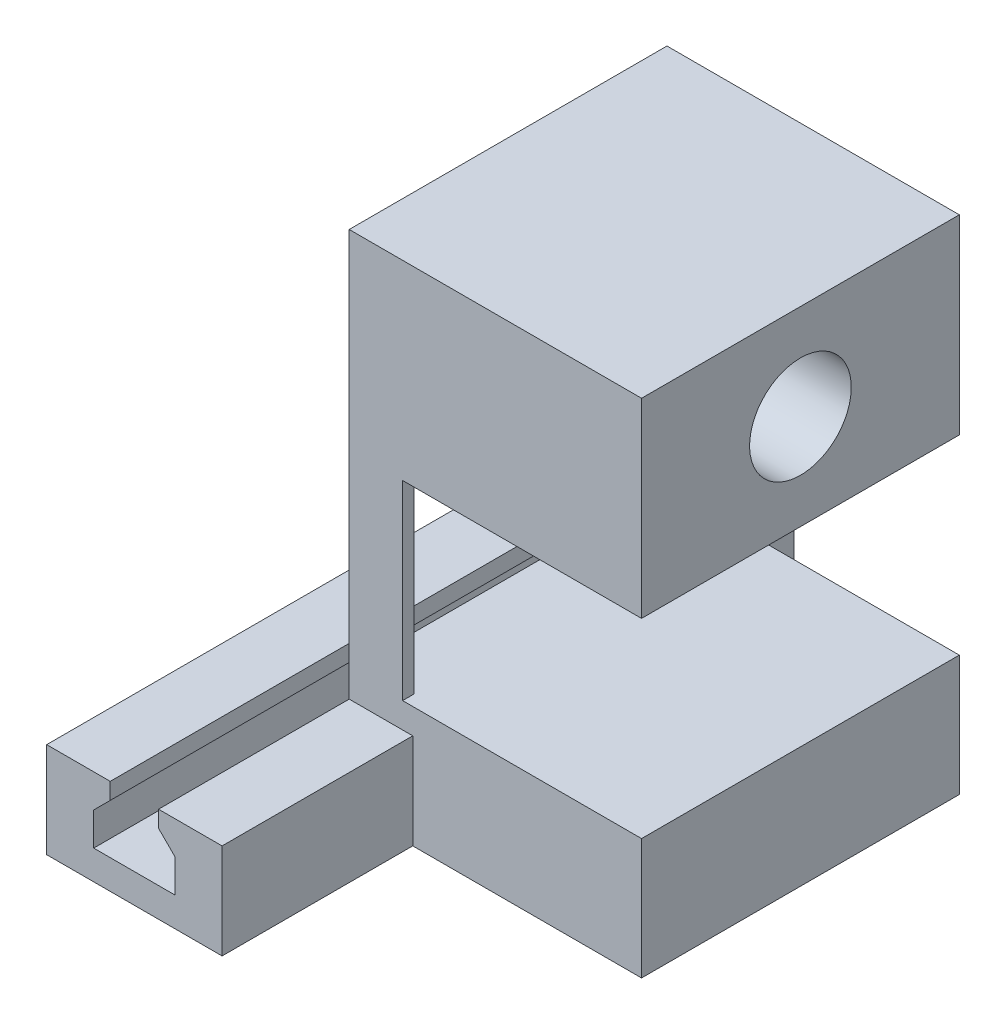
from build123d import *

# Parameters (mm, degrees)
BOSS_EXTRU_1_DEPTH      = 45
ESQUISSE6_W             = 25
ESQUISSE6_H             = 7.5
BOSS_EXTRU_6_DEPTH      = 18
ESQUISSE7_W             = 23
ESQUISSE7_H             = 25
BOSS_EXTRU_7_DEPTH      = 2
ESQUISSE8_W             = 4.2
ESQUISSE8_H             = 0.9
BOSS_EXTRU_8_DEPTH      = 20
BOSS_EXTRU_9_DEPTH      = 10
BOSS_EXTRU_9_DEPTH_BACK = 5
ESQUISSE9_W             = 23
ESQUISSE9_H             = 25
ESQUISSE10_R            = 4
ENL_V_MAT_EXTRU_1_DEPTH = 67.483682208


with BuildPart() as part:
    # Esquisse1 → Boss.-Extru.1 (new body)
    with BuildSketch(Plane.XY):
        Polygon((-3.2, 0), (3.2, 0), (3.2, 2.6), (1.9, 3.9), (1.9, 5.2), (6.9, 5.2), (6.9, -2.3), (-6.9, -2.3), (-6.9, 5.2), (-1.9, 5.2), (-1.9, 3.9), (-3.2, 2.6), align=None)
    extrude(amount=BOSS_EXTRU_1_DEPTH)

    # Esquisse6 → Boss.-Extru.6 (add)
    with BuildSketch(Plane(origin=(6.9, 0, 0), x_dir=(0, 0, -1), z_dir=(1, 0, 0))):
        with Locations((-17.5, 1.45)):
            Rectangle(ESQUISSE6_W, ESQUISSE6_H)
    extrude(amount=BOSS_EXTRU_6_DEPTH)

    # Esquisse7 → Boss.-Extru.7 (add)
    with BuildSketch(Plane(origin=(0, 5.2, 0), x_dir=(1, 0, 0), z_dir=(0, 1, 0))):
        with Locations((13.4, -17.5)):
            Rectangle(ESQUISSE7_W, ESQUISSE7_H)
    extrude(amount=BOSS_EXTRU_7_DEPTH)

    # Esquisse8 → Boss.-Extru.8 (add)
    with BuildSketch(Plane(origin=(0, 7.2, 0), x_dir=(1, 0, 0), z_dir=(0, 1, 0))):
        with Locations((4, -29.55)):
            Rectangle(ESQUISSE8_W, ESQUISSE8_H)
        with Locations((4, -5.45)):
            Rectangle(ESQUISSE8_W, ESQUISSE8_H)
    extrude(amount=BOSS_EXTRU_8_DEPTH)

    # Esquisse9 → Boss.-Extru.9 (add, two sides: drawn at the far end of the back side and taken through both)
    with BuildSketch(Plane(origin=(0, 27.2, 0), x_dir=(1, 0, 0), z_dir=(0, 1, 0)).offset(-BOSS_EXTRU_9_DEPTH_BACK)):
        with Locations((13.4, -17.5)):
            Rectangle(ESQUISSE9_W, ESQUISSE9_H)
    extrude(amount=BOSS_EXTRU_9_DEPTH + BOSS_EXTRU_9_DEPTH_BACK)

    # Esquisse10 → Enlèv. mat.-Extru.1 (cut, through all)
    with BuildSketch(Plane(origin=(24.9, 0, 0), x_dir=(0, 0, -1), z_dir=(1, 0, 0))):
        with Locations((-17.5, 29.7)):
            Circle(ESQUISSE10_R)
    extrude(amount=-ENL_V_MAT_EXTRU_1_DEPTH, mode=Mode.SUBTRACT)


solid = part.part
